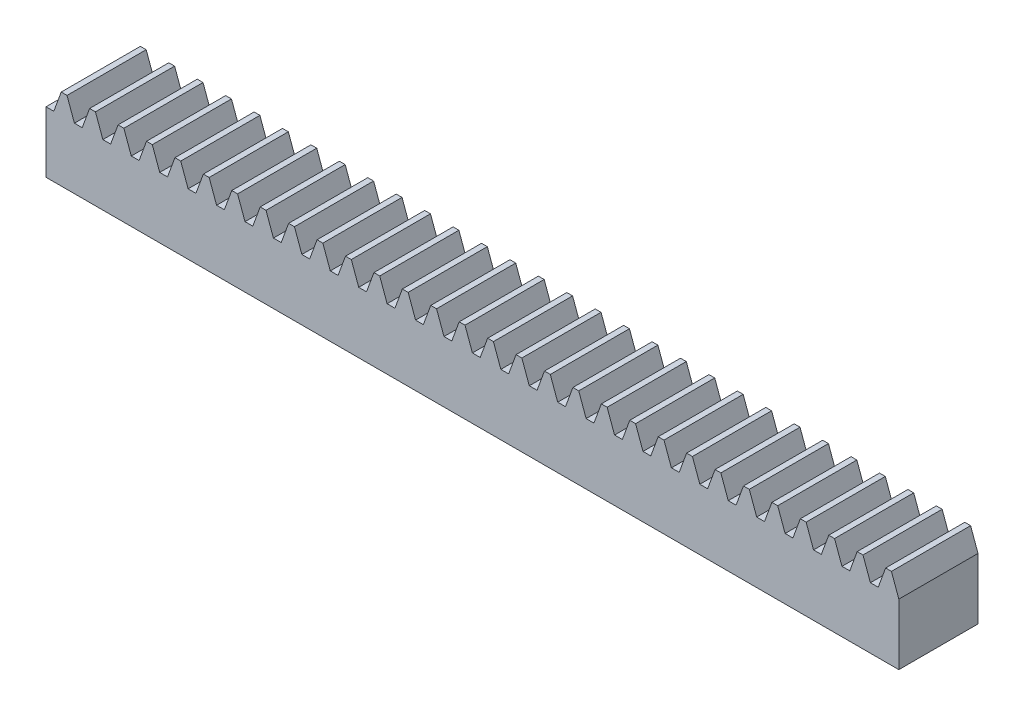
from build123d import *

# Parameters (mm, degrees)
BLANKSKE_W                   = 500
BLANKSKE_H                   = 45
BLANK_DEPTH                  = 20
TOOTHCUTSIM_DEPTH            = 503.419147724
TEETHCUTS_COUNT              = 33
TEETHCUTS_PITCH              = 15.70796325
SCALA1_SCALE                 = 0.16
ESTRUSIONE_ESTRUSIONE1_DEPTH = 3.8
TAGLIO_ESTRUSIONE2_DEPTH     = 10
TAGLIO_ESTRUSIONE3_DEPTH     = 10


with BuildPart() as part:
    # BlankSke → Blank (new body)
    with BuildSketch(Plane.XY):
        with Locations((250, 22.5)):
            Rectangle(BLANKSKE_W, BLANKSKE_H)
    extrude(amount=-BLANK_DEPTH)

    # TooCutSkeSim → ToothCutSim (cut, through all)
    with BuildSketch(Plane.XY):
        Polygon((2.153176848, 33.75), (-2.153176848, 33.75), (-6.257086828, 45.0254), (6.257086828, 45.0254), align=None)
    toothcutsim = extrude(amount=-TOOTHCUTSIM_DEPTH, mode=Mode.SUBTRACT)

    # TeethCuts: ToothCutSim ×33
    with Locations(*[(i * TEETHCUTS_PITCH, 0, 0) for i in range(1, TEETHCUTS_COUNT)]):
        add(toothcutsim, mode=Mode.SUBTRACT)


with BuildPart() as part_1:
    # Scala1: scaled about (250.174583298, 19.767382057, -10)
    add(part.part.scale(SCALA1_SCALE).moved(Location((210.14664997, 16.604600928, -8.4))))

    # Schizzo1 → Estrusione-Estrusione1 (add)
    with BuildSketch(Plane.XY.offset(-8.4)):
        Polygon((290.14664997, 16.604600928), (290.14664997, 22.225123203), (289.571767093, 23.804600928), (289.057802407, 23.804600928), (288.402655986, 22.004600928), (287.713639394, 22.004600928), (287.058492973, 23.804600928), (286.544528287, 23.804600928), (285.889381866, 22.004600928), (285.200365274, 22.004600928), (284.545218853, 23.804600928), (284.031254167, 23.804600928), (283.376107746, 22.004600928), (282.687091154, 22.004600928), (282.031944733, 23.804600928), (281.517980047, 23.804600928), (280.862833626, 22.004600928), (280.173817034, 22.004600928), (279.518670613, 23.804600928), (279.004705927, 23.804600928), (278.349559506, 22.004600928), (277.660542914, 22.004600928), (277.005396493, 23.804600928), (276.491431807, 23.804600928), (275.836285386, 22.004600928), (275.147268794, 22.004600928), (274.492122373, 23.804600928), (273.978157687, 23.804600928), (273.323011266, 22.004600928), (272.633994674, 22.004600928), (271.978848253, 23.804600928), (271.464883567, 23.804600928), (270.809737146, 22.004600928), (270.120720554, 22.004600928), (269.465574133, 23.804600928), (268.951609447, 23.804600928), (268.296463026, 22.004600928), (267.607446434, 22.004600928), (266.952300013, 23.804600928), (266.438335327, 23.804600928), (265.783188906, 22.004600928), (265.094172314, 22.004600928), (264.439025893, 23.804600928), (263.925061207, 23.804600928), (263.269914786, 22.004600928), (262.580898194, 22.004600928), (261.925751773, 23.804600928), (261.411787087, 23.804600928), (260.756640666, 22.004600928), (260.067624074, 22.004600928), (259.412477653, 23.804600928), (258.898512967, 23.804600928), (258.243366546, 22.004600928), (257.554349954, 22.004600928), (256.899203533, 23.804600928), (256.385238847, 23.804600928), (255.730092426, 22.004600928), (255.041075834, 22.004600928), (254.385929413, 23.804600928), (253.871964727, 23.804600928), (253.216818306, 22.004600928), (252.527801714, 22.004600928), (251.872655293, 23.804600928), (251.358690607, 23.804600928), (250.703544186, 22.004600928), (250.014527594, 22.004600928), (249.359381173, 23.804600928), (248.845416487, 23.804600928), (248.190270066, 22.004600928), (247.501253474, 22.004600928), (246.846107053, 23.804600928), (246.332142367, 23.804600928), (245.676995946, 22.004600928), (244.987979354, 22.004600928), (244.332832933, 23.804600928), (243.818868247, 23.804600928), (243.163721826, 22.004600928), (242.474705234, 22.004600928), (241.819558813, 23.804600928), (241.305594127, 23.804600928), (240.650447706, 22.004600928), (239.961431114, 22.004600928), (239.306284693, 23.804600928), (238.792320007, 23.804600928), (238.137173586, 22.004600928), (237.448156994, 22.004600928), (236.793010573, 23.804600928), (236.279045887, 23.804600928), (235.623899466, 22.004600928), (234.934882874, 22.004600928), (234.279736453, 23.804600928), (233.765771767, 23.804600928), (233.110625346, 22.004600928), (232.421608754, 22.004600928), (231.766462333, 23.804600928), (231.252497647, 23.804600928), (230.597351226, 22.004600928), (229.908334634, 22.004600928), (229.253188213, 23.804600928), (228.739223527, 23.804600928), (228.084077106, 22.004600928), (227.395060514, 22.004600928), (226.739914093, 23.804600928), (226.225949407, 23.804600928), (225.570802986, 22.004600928), (224.881786394, 22.004600928), (224.226639973, 23.804600928), (223.712675287, 23.804600928), (223.057528866, 22.004600928), (222.368512274, 22.004600928), (221.713365853, 23.804600928), (221.199401167, 23.804600928), (220.544254746, 22.004600928), (219.855238154, 22.004600928), (219.200091733, 23.804600928), (218.686127047, 23.804600928), (218.030980626, 22.004600928), (217.341964034, 22.004600928), (216.686817613, 23.804600928), (216.172852927, 23.804600928), (215.517706506, 22.004600928), (214.828689914, 22.004600928), (214.173543493, 23.804600928), (213.659578807, 23.804600928), (213.004432386, 22.004600928), (212.315415794, 22.004600928), (211.660269373, 23.804600928), (211.146304687, 23.804600928), (210.491158266, 22.004600928), (210.14664997, 22.004600928), (210.14664997, 16.604600928), align=None)
    extrude(amount=ESTRUSIONE_ESTRUSIONE1_DEPTH)

    # Schizzo2 → Taglio-Estrusione2 (cut, symmetric)
    with BuildSketch(Plane(origin=(0, 22.004600928, 0), x_dir=(1, 0, 0), z_dir=(0, 1, 0))):
        Polygon((212.315415794, 11.6), (212.315415794, 4.6), (208.462167245, 2.347877262), (205.897247637, 4.6), (205.110337821, 10.211571909), (209.734386357, 15.720465951), (212.233893697, 13.52577833), align=None)
    extrude(amount=TAGLIO_ESTRUSIONE2_DEPTH, both=True, mode=Mode.SUBTRACT)

    # Schizzo3 → Taglio-Estrusione3 (cut, symmetric)
    with BuildSketch(Plane(origin=(0, 22.004600928, 0), x_dir=(1, 0, 0), z_dir=(0, 1, 0))):
        Polygon((287.713639394, 4.6), (287.713639394, 11.6), (292.791663961, 17.742043918), (298.093315887, 11.169927051), (295.206395546, 3.598494096), (291.083357716, 1.033572149), (287.713639394, 3.819536015), align=None)
    extrude(amount=TAGLIO_ESTRUSIONE3_DEPTH, both=True, mode=Mode.SUBTRACT)


solid = part_1.part
